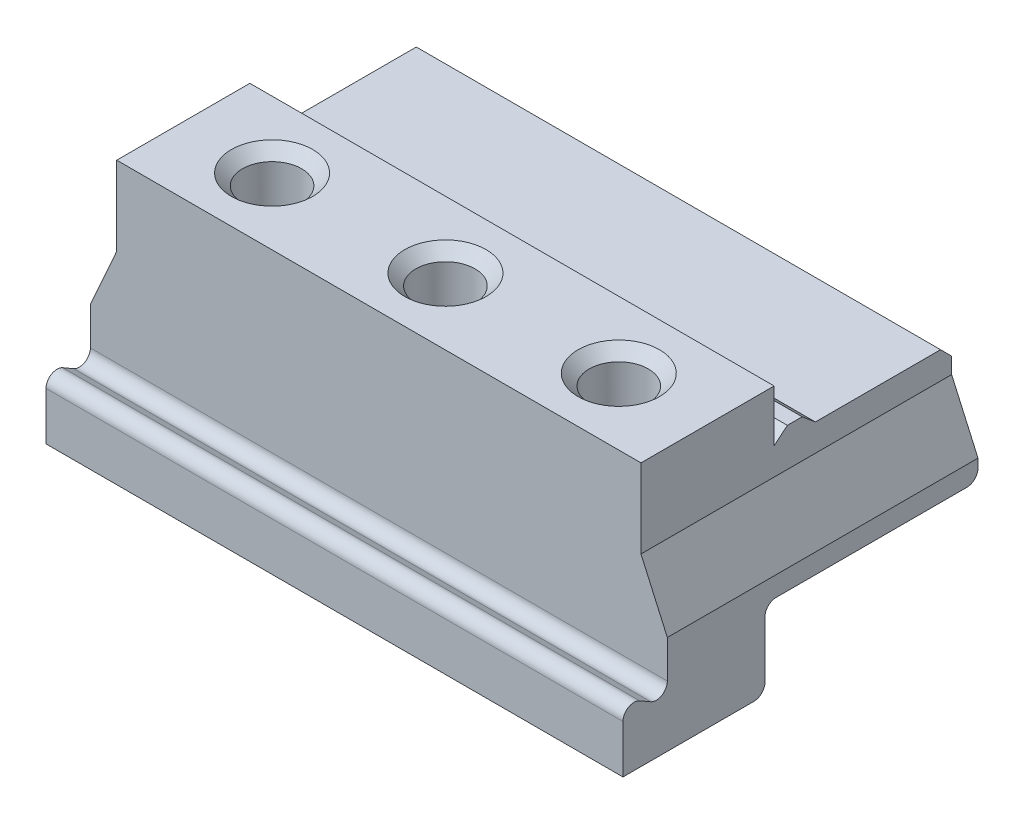
from build123d import *

# Parameters (mm, degrees)
BOSS_EXTRUDE1_DEPTH = 48
CUT_EXTRUDE1_DEPTH  = 98.015462685
CHAMFER1_SIZE       = 1.5
SKETCH3_R           = 4
CUT_EXTRUDE2_DEPTH  = 10
CHAMFER3_SIZE       = 1.5


with BuildPart() as part:
    # Sketch1 → Boss-Extrude1 (new body)
    with BuildSketch(Plane.XY):
        Polygon((0, 0), (78, 0), (78, 13.333333333), (74.438170518, 21.333333333), (74.438170518, 32), (3.561829482, 32), (3.561829482, 21.333333333), (0, 13.333333333), align=None)
    extrude(amount=-BOSS_EXTRUDE1_DEPTH)

    # Sketch2 → Cut-Extrude1 (cut, through all)
    with BuildSketch(Plane(origin=(78, 0, 0), x_dir=(0, 0, -1), z_dir=(1, 0, 0))):
        with BuildLine():
            ThreePointArc((0, 6.5), (0.75, 7.799038106), (2.25, 7.799038106))
            Line((2.25, 7.799038106), (3.75, 6.933012702))
            ThreePointArc((3.75, 6.933012702), (5.25, 6.933012702), (6, 8.232050808))
            Line((6, 8.232050808), (6, 32))
            Line((6, 32), (0, 32))
            Line((0, 32), (0, 6.5))
        make_face()
        with BuildLine():
            ThreePointArc((19.2, 1.5), (18.760660172, 0.439339828), (17.7, 0))
            Line((17.7, 0), (48, 0))
            Line((48, 0), (48, 12.166666667))
            ThreePointArc((48, 12.166666667), (47.560660172, 11.106006495), (46.5, 10.666666667))
            Line((46.5, 10.666666667), (20.7, 10.666666667))
            ThreePointArc((20.7, 10.666666667), (19.639339828, 10.227326838), (19.2, 9.166666667))
            Line((19.2, 9.166666667), (19.2, 1.5))
        make_face()
        Polygon((48, 32), (24, 32), (24, 25), (25.787630389, 26.5), (27.787630389, 26.5), (29.575260778, 25), (48, 25), align=None)
    extrude(amount=-CUT_EXTRUDE1_DEPTH, mode=Mode.SUBTRACT)

    # Chamfer1
    chamfer1_edges = [part.edges().sort_by_distance(p)[0] for p in [
        (39, 25, -48),
    ]]
    chamfer(chamfer1_edges, length=CHAMFER1_SIZE)

    # Sketch3 → Cut-Extrude2 (cut)
    with BuildSketch(Plane(origin=(0, 32, 0), x_dir=(1, 0, 0), z_dir=(0, 1, 0))):
        with Locations((39, 15)):
            Circle(SKETCH3_R)
        with Locations((15.561829482, 15)):
            Circle(SKETCH3_R)
        with Locations((62.438170518, 15)):
            Circle(SKETCH3_R)
    extrude(amount=-CUT_EXTRUDE2_DEPTH, mode=Mode.SUBTRACT)

    # Chamfer3
    chamfer3_edges = [part.edges().sort_by_distance(p)[0] for p in [
        (58.438170518, 32, -15),
        (35, 32, -15),
        (11.561829482, 32, -15),
    ]]
    chamfer(chamfer3_edges, length=CHAMFER3_SIZE)


solid = part.part
